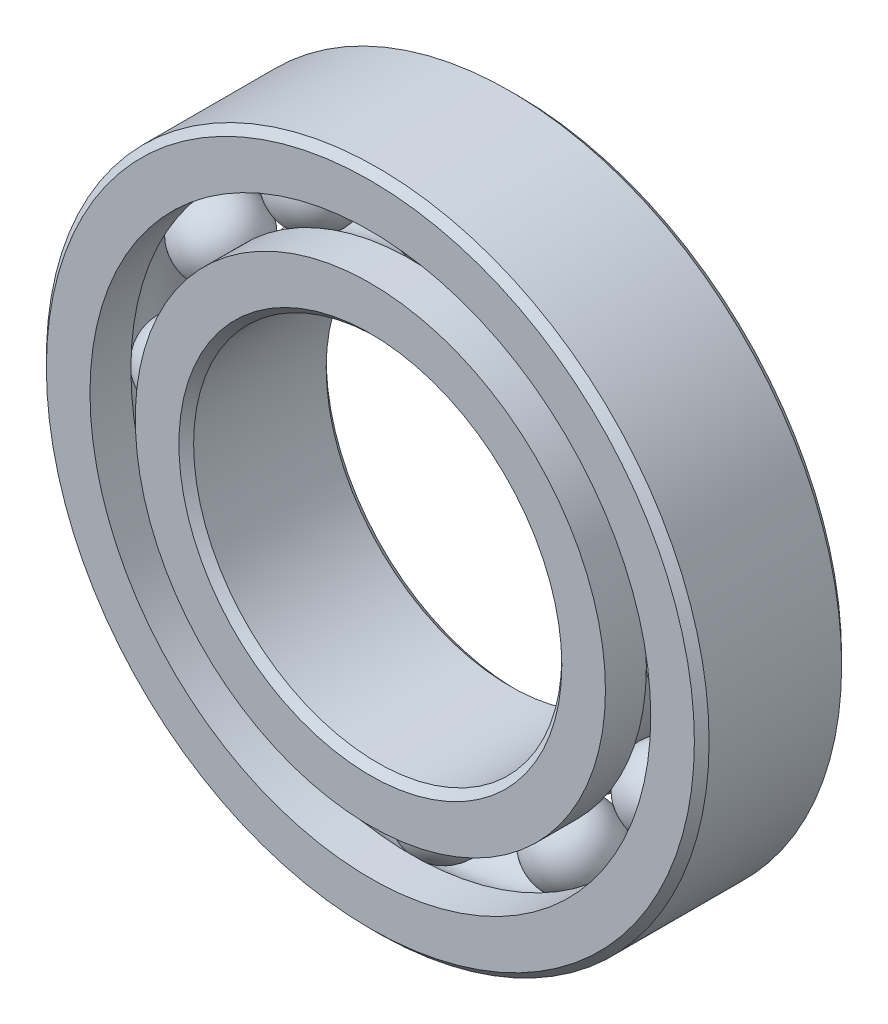
from build123d import *

# Parameters (mm, degrees)
CIRPATTERN1_COUNT = 12


with BuildPart() as part:
    # Sketch1 → Revolve1 (revolve)
    with BuildSketch(Plane(origin=(0, 0, 0), x_dir=(0, 0, -1), z_dir=(1, 0, 0))):
        with BuildLine():
            Line((9, 45), (-9, 45))
            Line((-9, 45), (-10, 44))
            Line((-10, 44), (-10, 38.076923077))
            Line((-10, 38.076923077), (-4.444444444, 38.076923077))
            ThreePointArc((-4.444444444, 38.076923077), (0, 40.405602838), (4.444444444, 38.076923077))
            Line((4.444444444, 38.076923077), (10, 38.076923077))
            Line((10, 38.076923077), (10, 44))
            Line((10, 44), (9, 45))
        make_face()
    revolve(axis=Axis((0, 0, 10), (0, 0, -1)))


with BuildPart() as body_2:
    # Sketch3 → Revolve3 (revolve)
    with BuildSketch(Plane(origin=(0, 0, 0), x_dir=(0, 0, -1), z_dir=(1, 0, 0))):
        with BuildLine():
            Line((-10, 31.923076923), (-4.444444444, 31.923076923))
            ThreePointArc((-4.444444444, 31.923076923), (0, 29.594397162), (4.444444444, 31.923076923))
            Line((4.444444444, 31.923076923), (10, 31.923076923))
            Line((10, 31.923076923), (10, 26))
            Line((10, 26), (9, 25))
            Line((9, 25), (-9, 25))
            Line((-9, 25), (-10, 26))
            Line((-10, 26), (-10, 31.923076923))
        make_face()
    revolve(axis=Axis((0, 0, 10), (0, 0, -1)))


with BuildPart() as body_3:
    # Sketch4 → Revolve4 (revolve)
    with BuildSketch(Plane(origin=(0, 0, 0), x_dir=(0, 0, -1), z_dir=(1, 0, 0))):
        with BuildLine():
            Line((-5.405602838, 35), (5.405602838, 35))
            ThreePointArc((5.405602838, 35), (0, 40.405602838), (-5.405602838, 35))
        make_face()
    revolve(axis=Axis((0, 35, 5.405602838), (0, 0, -1)))


with BuildPart() as cirpattern1_1:
    # CirPattern1: pattern copy
    add(body_3.part.rotate(Axis((0, 0, -10), (0, 0, 1)), 1 * 360 / CIRPATTERN1_COUNT))


with BuildPart() as cirpattern1_2:
    # CirPattern1: pattern copy
    add(body_3.part.rotate(Axis((0, 0, -10), (0, 0, 1)), 2 * 360 / CIRPATTERN1_COUNT))


with BuildPart() as cirpattern1_3:
    # CirPattern1: pattern copy
    add(body_3.part.rotate(Axis((0, 0, -10), (0, 0, 1)), 3 * 360 / CIRPATTERN1_COUNT))


with BuildPart() as cirpattern1_4:
    # CirPattern1: pattern copy
    add(body_3.part.rotate(Axis((0, 0, -10), (0, 0, 1)), 4 * 360 / CIRPATTERN1_COUNT))


with BuildPart() as cirpattern1_5:
    # CirPattern1: pattern copy
    add(body_3.part.rotate(Axis((0, 0, -10), (0, 0, 1)), 5 * 360 / CIRPATTERN1_COUNT))


with BuildPart() as cirpattern1_6:
    # CirPattern1: pattern copy
    add(body_3.part.rotate(Axis((0, 0, -10), (0, 0, 1)), 6 * 360 / CIRPATTERN1_COUNT))


with BuildPart() as cirpattern1_7:
    # CirPattern1: pattern copy
    add(body_3.part.rotate(Axis((0, 0, -10), (0, 0, 1)), 7 * 360 / CIRPATTERN1_COUNT))


with BuildPart() as cirpattern1_8:
    # CirPattern1: pattern copy
    add(body_3.part.rotate(Axis((0, 0, -10), (0, 0, 1)), 8 * 360 / CIRPATTERN1_COUNT))


with BuildPart() as cirpattern1_9:
    # CirPattern1: pattern copy
    add(body_3.part.rotate(Axis((0, 0, -10), (0, 0, 1)), 9 * 360 / CIRPATTERN1_COUNT))


with BuildPart() as cirpattern1_10:
    # CirPattern1: pattern copy
    add(body_3.part.rotate(Axis((0, 0, -10), (0, 0, 1)), 10 * 360 / CIRPATTERN1_COUNT))


with BuildPart() as cirpattern1_11:
    # CirPattern1: pattern copy
    add(body_3.part.rotate(Axis((0, 0, -10), (0, 0, 1)), 11 * 360 / CIRPATTERN1_COUNT))


solid = Compound([part.part, body_2.part, body_3.part, cirpattern1_1.part, cirpattern1_2.part, cirpattern1_3.part, cirpattern1_4.part, cirpattern1_5.part, cirpattern1_6.part, cirpattern1_7.part, cirpattern1_8.part, cirpattern1_9.part, cirpattern1_10.part, cirpattern1_11.part])
